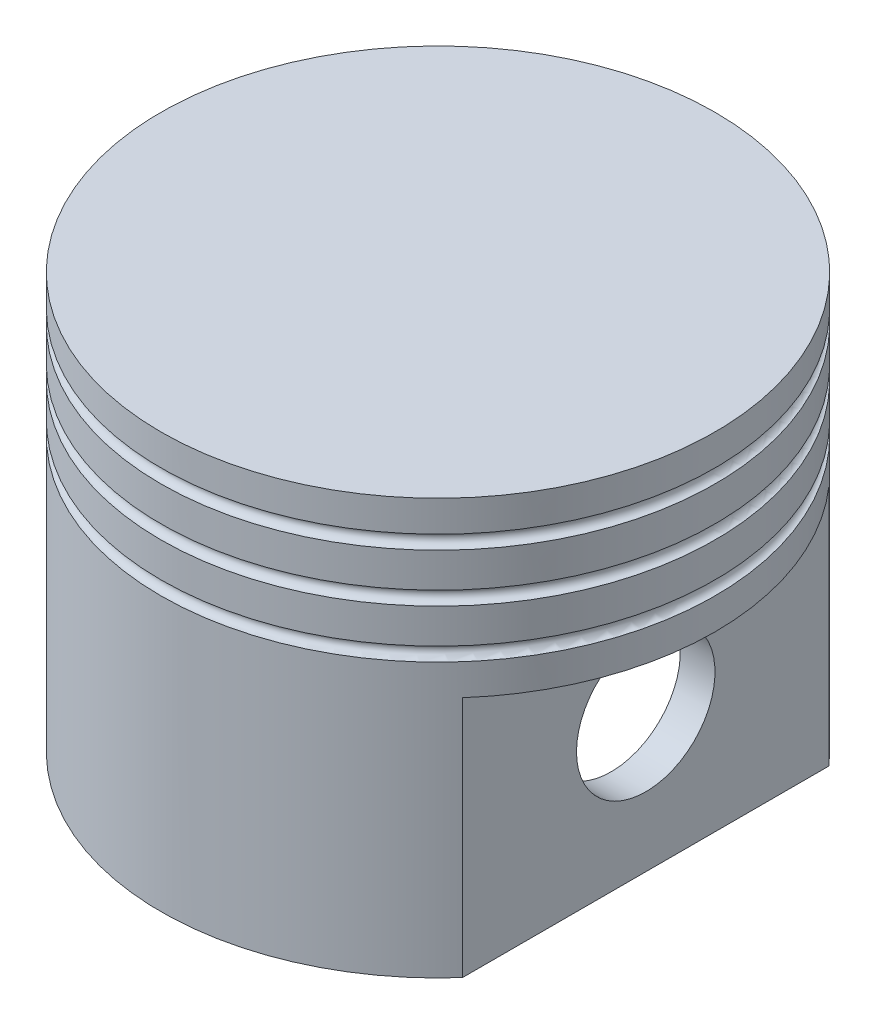
from build123d import *

# Parameters (mm, degrees)
SKETCH1_R           = 40
BOSS_EXTRUDE1_DEPTH = 60
CUT_EXTRUDE1_DEPTH  = 35
SKETCH4_R           = 1
SHELL1_DEPTH        = 37.18337511
SHELL1_START        = 43.81662469
SHELL1_2_DEPTH      = 0.36675042
SHELL1_START_2      = 50.81662469
SHELL1_3_DEPTH      = 0.36675042
SHELL1_START_3      = 37.18337521
SHELL1_5_DEPTH      = 2.81662479
SKETCH5_R           = 10
CUT_EXTRUDE2_DEPTH  = 101.498756211


with BuildPart() as part:
    # Sketch1 → Boss-Extrude1 (new body)
    with BuildSketch(Plane(origin=(0, 0, 0), x_dir=(1, 0, 0), z_dir=(0, 1, 0))):
        with Locations(Location((0, 0, 0), (0, 0, 270))):
            Circle(SKETCH1_R)
    extrude(amount=BOSS_EXTRUDE1_DEPTH)

    # Sketch3 → Cut-Extrude1 (cut)
    with BuildSketch(Plane.XZ):
        with BuildLine():
            Line((-30, 26.457513111), (-30, -26.457513111))
            ThreePointArc((-30, -26.457513111), (-40, 0), (-30, 26.457513111))
        make_face()
        with BuildLine():
            Line((30, -26.457513111), (30, 26.457513111))
            ThreePointArc((30, 26.457513111), (40, 0), (30, -26.457513111))
        make_face()
    extrude(amount=-CUT_EXTRUDE1_DEPTH, mode=Mode.SUBTRACT)

    # Sketch4 → Cut-Revolve1 (revolve, cut)
    with BuildSketch(Plane.XY, mode=Mode.PRIVATE) as cut_revolve1_sk:
        with Locations((-40, 54.5)):
            Circle(SKETCH4_R)
        with Locations((-40, 47.5)):
            Circle(SKETCH4_R)
        with Locations((-40, 40.5)):
            Circle(SKETCH4_R)
    revolve(cut_revolve1_sk.sketch.rotate(Axis((0, 60, 0), (0, -1, 0)), 90), axis=Axis((0, 60, 0), (0, -1, 0)), mode=Mode.SUBTRACT)

    # Shell1: read off the stored shape, not the designer's step
    # Shell1 outline → Shell1 (cut)
    with BuildSketch(Plane(origin=(0, 0, 0), x_dir=(1, 0, 0), z_dir=(0, 1, 0))):
        with BuildLine():
            ThreePointArc((25, 24.494897428), (0, 35), (-25, 24.494897428))
            Line((-25, 24.494897428), (-25, -24.494897428))
            ThreePointArc((-25, -24.494897428), (0, -35), (25, -24.494897428))
            Line((25, -24.494897428), (25, 24.494897428))
        make_face()
    extrude(amount=SHELL1_DEPTH, mode=Mode.SUBTRACT)

    # Shell1 2 outline → Shell1 2 (cut)
    with BuildSketch(Plane(origin=(0, 0, 0), x_dir=(1, 0, 0), z_dir=(0, 1, 0)).offset(SHELL1_START)):
        with BuildLine():
            ThreePointArc((-25, 24.494897428), (0, -35), (25, 24.494897428))
            ThreePointArc((25, 24.494897428), (0, 35), (-25, 24.494897428))
        make_face()
    extrude(amount=SHELL1_2_DEPTH, mode=Mode.SUBTRACT)

    # Shell1 3 outline → Shell1 3 (cut)
    with BuildSketch(Plane(origin=(0, 0, 0), x_dir=(1, 0, 0), z_dir=(0, 1, 0)).offset(SHELL1_START_2)):
        with BuildLine():
            ThreePointArc((-25, 24.494897428), (0, -35), (25, 24.494897428))
            ThreePointArc((25, 24.494897428), (0, 35), (-25, 24.494897428))
        make_face()
    extrude(amount=SHELL1_3_DEPTH, mode=Mode.SUBTRACT)

    # Shell1 4 outline → Shell1 4 (revolve, cut)
    with BuildSketch(Plane.XY):
        with BuildLine():
            Line((34.020869628, 55), (0, 55))
            Line((0, 55), (0, 51.18337521))
            Line((0, 51.18337521), (35, 51.18337521))
            ThreePointArc((35, 51.18337521), (34.188203193, 53.009021169), (34.020869628, 55))
        make_face()
        with BuildLine():
            Line((35, 50.81662479), (0, 50.81662479))
            Line((0, 50.81662479), (0, 44.18337521))
            Line((0, 44.18337521), (35, 44.18337521))
            ThreePointArc((35, 44.18337521), (34, 47.5), (35, 50.81662479))
        make_face()
        with BuildLine():
            Line((35, 43.81662479), (0, 43.81662479))
            Line((0, 43.81662479), (0, 37.18337521))
            Line((0, 37.18337521), (35, 37.18337521))
            ThreePointArc((35, 37.18337521), (34, 40.5), (35, 43.81662479))
        make_face()
    revolve(axis=Axis((0, 0, 0), (0, 1, 0)), mode=Mode.SUBTRACT)

    # Shell1 5 outline → Shell1 5 (add)
    with BuildSketch(Plane(origin=(0, 0, 0), x_dir=(1, 0, 0), z_dir=(0, 1, 0)).offset(SHELL1_START_3)):
        with BuildLine():
            ThreePointArc((-25, 24.494897428), (-35, 0), (-25, -24.494897428))
            Line((-25, -24.494897428), (-25, 24.494897428))
        make_face()
        with BuildLine():
            ThreePointArc((25, -24.494897428), (35, 0), (25, 24.494897428))
            Line((25, 24.494897428), (25, -24.494897428))
        make_face()
    extrude(amount=SHELL1_5_DEPTH)

    # Sketch5 → Cut-Extrude2 (cut, through all)
    with BuildSketch(Plane.ZY.offset(30)):
        with Locations((0, 20)):
            Circle(SKETCH5_R)
    extrude(amount=-CUT_EXTRUDE2_DEPTH, mode=Mode.SUBTRACT)


solid = part.part
